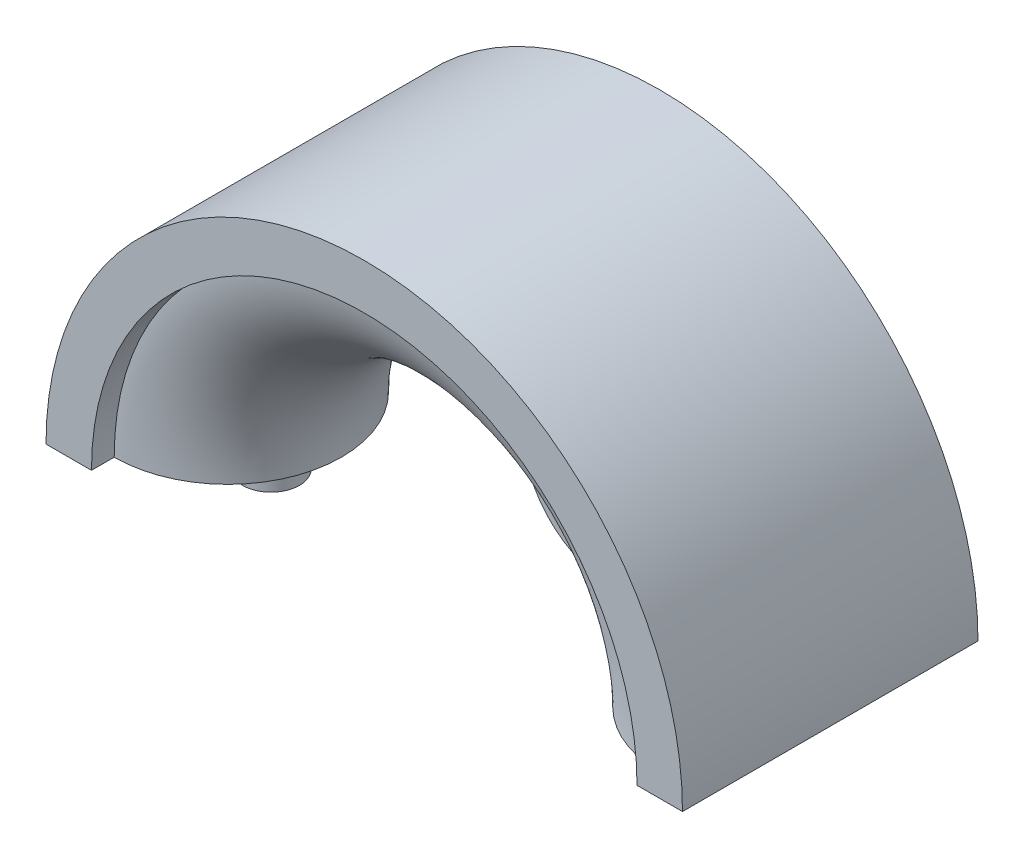
from build123d import *

# Parameters (mm, degrees)
SKETCH_1_R              = 12
EXTRUDE_1_DEPTH         = 12
DELETE_BODY_1_OUTLINE_R = 5
DELETE_BODY_1_DEPTH     = 12
EXTRUDE_START           = -1
SKETCH_2_R              = 12
EXTRUDE_2_DEPTH         = 1
SKETCH_3_W              = 2
SKETCH_3_H              = 13
SKETCH_5_W              = 34.262916627
SKETCH_5_H              = 20.154656839
CUT_EXTRUDE_3_DEPTH     = 24.151673806
SKETCH_6_R              = 1.25
EXTRUDE_4_DEPTH         = 2
SKETCH_7_R              = 4
EXTRUDE_5_DEPTH         = 2


# Read off the part's stored shape, not the designer's step: 型腔1, 实体-删除/保留 1
with BuildPart() as part:
    # 草图1 → 凸台-拉伸1 (new body)
    with BuildSketch(Plane.XY):
        Circle(SKETCH_1_R)
    extrude(amount=EXTRUDE_1_DEPTH)

    # 型腔1 outline → 型腔1 (revolve, cut)
    with BuildSketch(Plane.XZ):
        with BuildLine():
            Line((12, 12), (4, 12))
            Line((4, 12), (4, 8))
            Line((4, 8), (5, 8))
            Line((5, 8), (5, 4))
            Line((5, 4), (4, 4))
            Line((4, 4), (4, 0))
            Line((4, 0), (12, 0))
            Line((12, 0), (12, 1))
            ThreePointArc((12, 1), (7, 6), (12, 11))
            Line((12, 11), (12, 12))
        make_face()
    revolve(axis=Axis((0, 0, 0), (0, 0, 1)), mode=Mode.SUBTRACT)

    # Delete Body 1 outline → Delete Body 1 (cut)
    with BuildSketch(Plane.XY):
        Circle(DELETE_BODY_1_OUTLINE_R)
    extrude(amount=DELETE_BODY_1_DEPTH, mode=Mode.SUBTRACT)



with BuildPart() as body_2:
    # 草图2 → 凸台-拉伸2 (new body)
    with BuildSketch(Plane.XY.offset(EXTRUDE_START)):
        with Locations(Location((0, 0, 0), (0, 0, 270))):
            Circle(SKETCH_2_R)
    extrude(amount=EXTRUDE_2_DEPTH)


with BuildPart() as part_1:
    add(part.part)

    add(body_2.part)  # 旋转1 merges body 2
    # 草图3 → 旋转1 (revolve)
    with BuildSketch(Plane(origin=(0, 0, 0), x_dir=(1, 0, 0), z_dir=(0, 1, 0))):
        with Locations((-13, -5.5)):
            Rectangle(SKETCH_3_W, SKETCH_3_H)
    revolve(axis=Axis((0, 0, 0), (0, 0, 1)))

    # 草图5 → 切除-拉伸3 (cut, through all)
    with BuildSketch(Plane(origin=(0, 0, 0), x_dir=(1, 0, 0), z_dir=(0, 1, 0))):
        with Locations((0.6382308, -6.140467699)):
            Rectangle(SKETCH_5_W, SKETCH_5_H)
    extrude(amount=-CUT_EXTRUDE_3_DEPTH, mode=Mode.SUBTRACT)

    # 草图6 → 凸台-拉伸4 (add)
    with BuildSketch(Plane.XZ):
        with Locations(Location((-10.1, 6, 0), (0, 0, 90))):
            Circle(SKETCH_6_R)
        with Locations(Location((10.1, 6, 0), (0, 0, 90))):
            Circle(SKETCH_6_R)
    extrude(amount=EXTRUDE_4_DEPTH)

    # 草图7 → 凸台-拉伸5 (add)
    with BuildSketch(Plane(origin=(0, 0, -1), x_dir=(-1, 0, 0), z_dir=(0, 0, -1))):
        Circle(SKETCH_7_R)
    extrude(amount=-EXTRUDE_5_DEPTH)


solid = part_1.part
